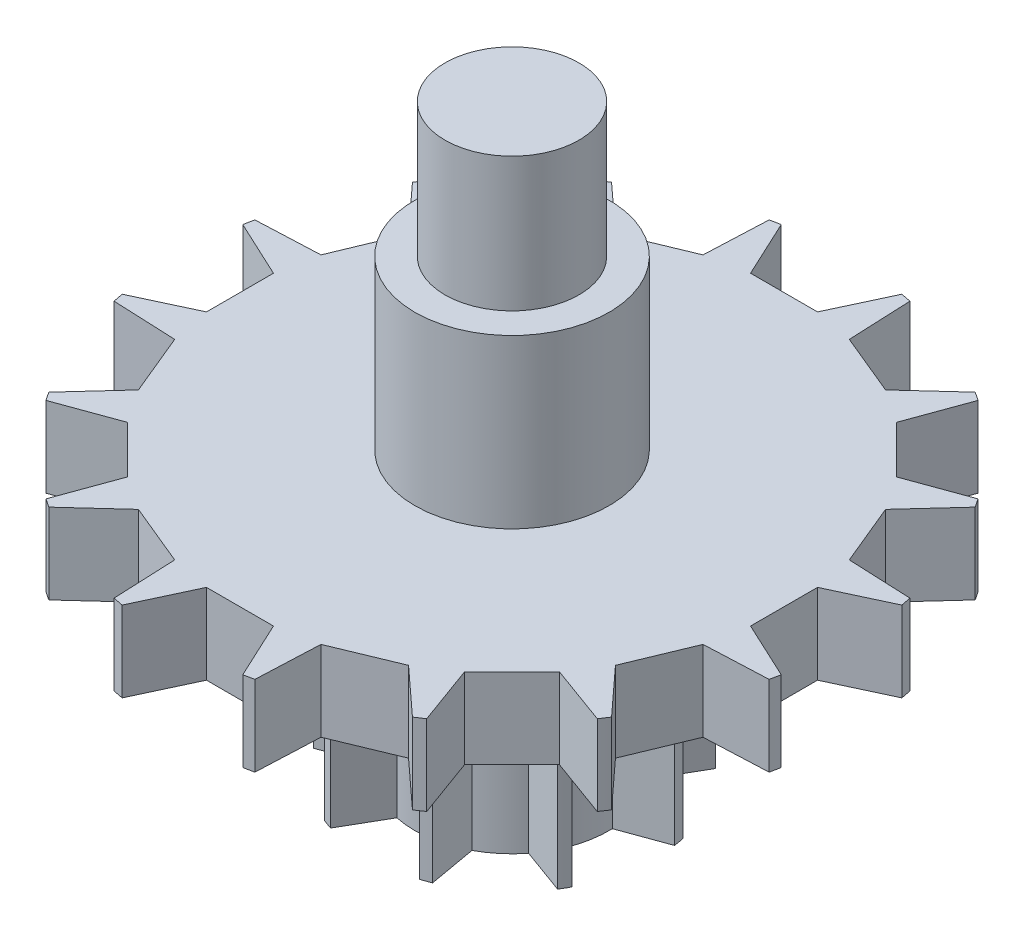
from build123d import *

# Parameters (mm, degrees)
BOSS_EXTRUDE1_DEPTH      = 0.6
BOSS_EXTRUDE2_DEPTH      = 1.25
BOSS_EXTRUDE2_DEPTH_BACK = 2.1
SKETCH2_R                = 0.725
SKETCH3_R                = 0.5
BOSS_EXTRUDE3_DEPTH      = 1
BOSS_EXTRUDE4_DEPTH      = 1.5


# Read off the part's stored shape, not the designer's step: Boss-Extrude1
with BuildPart() as part:
    # Boss-Extrude1 outline → Boss-Extrude1 (new body)
    with BuildSketch(Plane(origin=(0, 0, 0), x_dir=(1, 0, 0), z_dir=(0, 1, 0))):
        with BuildLine():
            Line((2.459166525, -0.45), (2.030265141, -0.25))
            Line((2.030265141, -0.25), (2.030265141, 0.25))
            Line((2.030265141, 0.25), (2.459166525, 0.45))
            ThreePointArc((2.459166525, 0.45), (2.451963201, 0.487725805), (2.444181164, 0.525336497))
            Line((2.444181164, 0.525336497), (1.971391268, 0.54597895))
            Line((1.971391268, 0.54597895), (1.780049552, 1.007918716))
            Line((1.780049552, 1.007918716), (2.099766075, 1.356828076))
            ThreePointArc((2.099766075, 1.356828076), (2.078674031, 1.388925583), (2.057091378, 1.420695275))
            Line((2.057091378, 1.420695275), (1.612390944, 1.258837554))
            Line((1.612390944, 1.258837554), (1.258837554, 1.612390944))
            Line((1.258837554, 1.612390944), (1.420695275, 2.057091378))
            ThreePointArc((1.420695275, 2.057091378), (1.388925583, 2.078674031), (1.356828076, 2.099766075))
            Line((1.356828076, 2.099766075), (1.007918716, 1.780049552))
            Line((1.007918716, 1.780049552), (0.54597895, 1.971391268))
            Line((0.54597895, 1.971391268), (0.525336497, 2.444181164))
            ThreePointArc((0.525336497, 2.444181164), (0.487725805, 2.451963201), (0.45, 2.459166525))
            Line((0.45, 2.459166525), (0.25, 2.030265141))
            Line((0.25, 2.030265141), (-0.25, 2.030265141))
            Line((-0.25, 2.030265141), (-0.45, 2.459166525))
            ThreePointArc((-0.45, 2.459166525), (-0.487725805, 2.451963201), (-0.525336497, 2.444181164))
            Line((-0.525336497, 2.444181164), (-0.54597895, 1.971391268))
            Line((-0.54597895, 1.971391268), (-1.007918716, 1.780049552))
            Line((-1.007918716, 1.780049552), (-1.356828076, 2.099766075))
            ThreePointArc((-1.356828076, 2.099766075), (-1.388925583, 2.078674031), (-1.420695275, 2.057091378))
            Line((-1.420695275, 2.057091378), (-1.258837554, 1.612390944))
            Line((-1.258837554, 1.612390944), (-1.612390944, 1.258837554))
            Line((-1.612390944, 1.258837554), (-2.057091378, 1.420695275))
            ThreePointArc((-2.057091378, 1.420695275), (-2.078674031, 1.388925583), (-2.099766075, 1.356828076))
            Line((-2.099766075, 1.356828076), (-1.780049552, 1.007918716))
            Line((-1.780049552, 1.007918716), (-1.971391268, 0.54597895))
            Line((-1.971391268, 0.54597895), (-2.444181164, 0.525336497))
            ThreePointArc((-2.444181164, 0.525336497), (-2.451963201, 0.487725805), (-2.459166525, 0.45))
            Line((-2.459166525, 0.45), (-2.030265141, 0.25))
            Line((-2.030265141, 0.25), (-2.030265141, -0.25))
            Line((-2.030265141, -0.25), (-2.459166525, -0.45))
            ThreePointArc((-2.459166525, -0.45), (-2.451963201, -0.487725805), (-2.444181164, -0.525336497))
            Line((-2.444181164, -0.525336497), (-1.971391268, -0.54597895))
            Line((-1.971391268, -0.54597895), (-1.780049552, -1.007918716))
            Line((-1.780049552, -1.007918716), (-2.099766075, -1.356828076))
            ThreePointArc((-2.099766075, -1.356828076), (-2.078674031, -1.388925583), (-2.057091378, -1.420695275))
            Line((-2.057091378, -1.420695275), (-1.612390944, -1.258837554))
            Line((-1.612390944, -1.258837554), (-1.258837554, -1.612390944))
            Line((-1.258837554, -1.612390944), (-1.420695275, -2.057091378))
            ThreePointArc((-1.420695275, -2.057091378), (-1.388925583, -2.078674031), (-1.356828076, -2.099766075))
            Line((-1.356828076, -2.099766075), (-1.007918716, -1.780049552))
            Line((-1.007918716, -1.780049552), (-0.54597895, -1.971391268))
            Line((-0.54597895, -1.971391268), (-0.525336497, -2.444181164))
            ThreePointArc((-0.525336497, -2.444181164), (-0.487725805, -2.451963201), (-0.45, -2.459166525))
            Line((-0.45, -2.459166525), (-0.25, -2.030265141))
            Line((-0.25, -2.030265141), (0.25, -2.030265141))
            Line((0.25, -2.030265141), (0.45, -2.459166525))
            ThreePointArc((0.45, -2.459166525), (0.487725805, -2.451963201), (0.525336497, -2.444181164))
            Line((0.525336497, -2.444181164), (0.54597895, -1.971391268))
            Line((0.54597895, -1.971391268), (1.007918716, -1.780049552))
            Line((1.007918716, -1.780049552), (1.356828076, -2.099766075))
            ThreePointArc((1.356828076, -2.099766075), (1.388925583, -2.078674031), (1.420695275, -2.057091378))
            Line((1.420695275, -2.057091378), (1.258837554, -1.612390944))
            Line((1.258837554, -1.612390944), (1.612390944, -1.258837554))
            Line((1.612390944, -1.258837554), (2.057091378, -1.420695275))
            ThreePointArc((2.057091378, -1.420695275), (2.078674031, -1.388925583), (2.099766075, -1.356828076))
            Line((2.099766075, -1.356828076), (1.780049552, -1.007918716))
            Line((1.780049552, -1.007918716), (1.971391268, -0.54597895))
            Line((1.971391268, -0.54597895), (2.444181164, -0.525336497))
            ThreePointArc((2.444181164, -0.525336497), (2.451963201, -0.487725805), (2.459166525, -0.45))
        make_face()
    extrude(amount=BOSS_EXTRUDE1_DEPTH)

    # Sketch2 → Boss-Extrude2 (add, two sides: drawn at the far end of the back side and taken through both)
    with BuildSketch(Plane(origin=(0, 0.6, 0), x_dir=(1, 0, 0), z_dir=(0, 1, 0)).offset(-BOSS_EXTRUDE2_DEPTH_BACK)):
        with Locations(Location((0, 0, 0), (0, 0, 270))):
            Circle(SKETCH2_R)
    extrude(amount=BOSS_EXTRUDE2_DEPTH + BOSS_EXTRUDE2_DEPTH_BACK)

    # Sketch3 → Boss-Extrude3 (add)
    with BuildSketch(Plane(origin=(0, 1.85, 0), x_dir=(1, 0, 0), z_dir=(0, 1, 0))):
        with Locations(Location((0, 0, 0), (0, 0, 270))):
            Circle(SKETCH3_R)
    extrude(amount=BOSS_EXTRUDE3_DEPTH)

    # Sketch4 → Boss-Extrude4 (add)
    with BuildSketch(Plane(origin=(0, 0, 0), x_dir=(-1, 0, 0), z_dir=(0, -1, 0))):
        with BuildLine():
            Line((0.15, -0.709313048), (0.330979791, -1.022779242))
            ThreePointArc((0.330979791, -1.022779242), (0.367671654, -1.010169567), (0.403884594, -0.996244064))
            Line((0.403884594, -0.996244064), (0.341030972, -0.63978346))
            ThreePointArc((0.341030972, -0.63978346), (0.247964604, -0.68127715), (0.15, -0.709313048))
        make_face()
        with BuildLine():
            ThreePointArc((-0.403884594, -0.996244064), (-0.367671654, -1.010169567), (-0.330979791, -1.022779242))
            Line((-0.330979791, -1.022779242), (-0.15, -0.709313048))
            ThreePointArc((-0.15, -0.709313048), (-0.247964604, -0.68127715), (-0.341030972, -0.63978346))
            Line((-0.341030972, -0.63978346), (-0.403884594, -0.996244064))
        make_face()
        with BuildLine():
            Line((0.570844305, -0.446947177), (0.910975054, -0.570744646))
            ThreePointArc((0.910975054, -0.570744646), (0.930977309, -0.5375), (0.949766889, -0.503555216))
            Line((0.949766889, -0.503555216), (0.672489762, -0.270892081))
            ThreePointArc((0.672489762, -0.270892081), (0.627868418, -0.3625), (0.570844305, -0.446947177))
        make_face()
        with BuildLine():
            ThreePointArc((-0.949766889, -0.503555216), (-0.930977309, -0.5375), (-0.910975054, -0.570744646))
            Line((-0.910975054, -0.570744646), (-0.570844305, -0.446947177))
            ThreePointArc((-0.570844305, -0.446947177), (-0.627868418, -0.3625), (-0.672489762, -0.270892081))
            Line((-0.672489762, -0.270892081), (-0.949766889, -0.503555216))
        make_face()
        with BuildLine():
            ThreePointArc((0.689283119, 0.224752713), (0.713985621, 0.125894929), (0.724584216, 0.024550245))
            Line((0.724584216, 0.024550245), (1.064714965, 0.148347713))
            ThreePointArc((1.064714965, 0.148347713), (1.058668334, 0.186671791), (1.051242702, 0.224752713))
            Line((1.051242702, 0.224752713), (0.689283119, 0.224752713))
        make_face()
        with BuildLine():
            ThreePointArc((-1.051242702, 0.224752713), (-1.058668334, 0.186671791), (-1.064714965, 0.148347713))
            Line((-1.064714965, 0.148347713), (-0.724584216, 0.024550245))
            ThreePointArc((-0.724584216, 0.024550245), (-0.713985621, 0.125894929), (-0.689283119, 0.224752713))
            Line((-0.689283119, 0.224752713), (-1.051242702, 0.224752713))
        make_face()
        with BuildLine():
            ThreePointArc((0.383553243, 0.615233215), (0.466021017, 0.555382221), (0.539283119, 0.484560335))
            Line((0.539283119, 0.484560335), (0.72026291, 0.798026528))
            ThreePointArc((0.72026291, 0.798026528), (0.69099668, 0.823497776), (0.660830371, 0.847896351))
            Line((0.660830371, 0.847896351), (0.383553243, 0.615233215))
        make_face()
        with BuildLine():
            ThreePointArc((-0.660830371, 0.847896351), (-0.69099668, 0.823497776), (-0.72026291, 0.798026528))
            Line((-0.72026291, 0.798026528), (-0.539283119, 0.484560335))
            ThreePointArc((-0.539283119, 0.484560335), (-0.466021017, 0.555382221), (-0.383553243, 0.615233215))
            Line((-0.383553243, 0.615233215), (-0.660830371, 0.847896351))
        make_face()
        with BuildLine():
            ThreePointArc((-0.101645457, 0.717839258), (0, 0.725), (0.101645457, 0.717839258))
            Line((0.101645457, 0.717839258), (0.038791835, 1.074299862))
            ThreePointArc((0.038791835, 1.074299862), (0, 1.075), (-0.038791835, 1.074299862))
            Line((-0.038791835, 1.074299862), (-0.101645457, 0.717839258))
        make_face()
    extrude(amount=BOSS_EXTRUDE4_DEPTH)


solid = part.part
